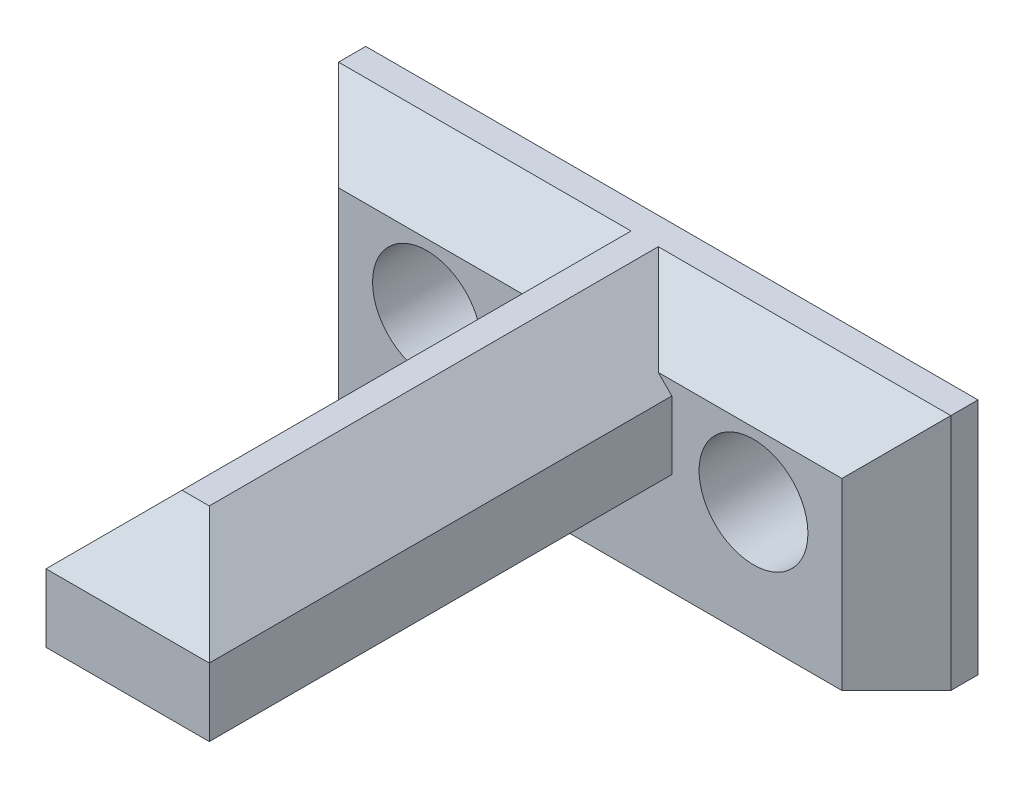
from build123d import *

# Parameters (mm, degrees)
SKETCH1_W           = 22.5
SKETCH1_H           = 8.75
SKETCH1_R           = 2
BOSS_EXTRUDE1_DEPTH = 3
SKETCH2_W           = 3
SKETCH2_H           = 17
BOSS_EXTRUDE2_DEPTH = 5
CHAMFER1_SIZE       = 2
CHAMFER2_SIZE       = 2.5


with BuildPart() as part:
    # Sketch1 → Boss-Extrude1 (new body)
    with BuildSketch(Plane.XY):
        Rectangle(SKETCH1_W, SKETCH1_H)
        with Locations((6, 0)):
            Circle(SKETCH1_R, mode=Mode.SUBTRACT)
        with Locations(Location((-6, 0, 0), (0, 0, 180))):
            Circle(SKETCH1_R, mode=Mode.SUBTRACT)
    extrude(amount=BOSS_EXTRUDE1_DEPTH)

    # Sketch2 → Boss-Extrude2 (add)
    with BuildSketch(Plane(origin=(0, 4.375, 0), x_dir=(1, 0, 0), z_dir=(0, 1, 0))):
        with Locations((-1.5, -11.5)):
            Rectangle(SKETCH2_W, SKETCH2_H)
        with Locations((1.5, -11.5)):
            Rectangle(SKETCH2_W, SKETCH2_H)
    extrude(amount=-BOSS_EXTRUDE2_DEPTH)

    # Chamfer1
    chamfer1_edges = [part.edges().sort_by_distance(p)[0] for p in [
        (-11.25, 0, 3),
        (-7.125, 4.375, 3),
        (11.25, 0, 3),
        (7.125, 4.375, 3),
    ]]
    chamfer(chamfer1_edges, length=CHAMFER1_SIZE)

    # Chamfer2
    # the kernel refuses this chamfer: 2.5 mm, written as the material it takes off along each edge
    with BuildSketch(Plane(origin=(3, 4.375, 26.42920747), x_dir=(0.027495876610586317, -0.9996219169112968, 0), z_dir=(0, 0, -1))) as chamfer2_piece_1_section:
        Polygon((CHAMFER2_SIZE * 0.999621916911, CHAMFER2_SIZE * 0.0274958766106), (-CHAMFER2_SIZE * 0.0274958766106, CHAMFER2_SIZE * 0.999621916911), (0, 0), align=None)
    chamfer2_piece_1 = extrude(amount=31.85841494, mode=Mode.PRIVATE)
    chamfer2_piece_1 = split(chamfer2_piece_1, bisect_by=Plane(origin=(2.16638878, 3.54222244, 3), z_dir=(0, 0, 1)), keep=Keep.TOP, mode=Mode.PRIVATE)
    add(chamfer2_piece_1, mode=Mode.SUBTRACT)
    with BuildSketch(Plane(origin=(3, 4.375, 26.42920747), x_dir=(0.027495876610586317, -0.9996219169112968, 0), z_dir=(0, 0, -1))) as chamfer2_piece_2_section:
        Polygon((CHAMFER2_SIZE * 0.999621916911, CHAMFER2_SIZE * 0.0274958766106), (-CHAMFER2_SIZE * 0.0274958766106, CHAMFER2_SIZE * 0.999621916911), (0, 0), align=None)
    chamfer2_piece_2 = extrude(amount=31.85841494, mode=Mode.PRIVATE)
    chamfer2_piece_2 = split(chamfer2_piece_2, bisect_by=Plane(origin=(2.022727273, 3.465909091, 1.909090909), z_dir=(0, 0.7071067811865476, 0.7071067811865476)), keep=Keep.TOP, mode=Mode.PRIVATE)
    add(chamfer2_piece_2, mode=Mode.SUBTRACT)
    with BuildSketch(Plane(origin=(9.42920747, 4.375, 20), x_dir=(0, -0.9996219169112968, 0.027495876610586317), z_dir=(-1, 0, 0))) as chamfer2_piece_3:
        Polygon((CHAMFER2_SIZE * 0.999621916911, -CHAMFER2_SIZE * 0.0274958766106), (-CHAMFER2_SIZE * 0.0274958766106, -CHAMFER2_SIZE * 0.999621916911), (0, 0), align=None)
    extrude(amount=18.85841494, mode=Mode.SUBTRACT)
    with BuildSketch(Plane(origin=(-3, 4.375, -5.42920747), x_dir=(-0.027495876610586147, -0.9996219169112968, 0), z_dir=(0, 0, 1))) as chamfer2_piece_4_section:
        Polygon((CHAMFER2_SIZE * 0.999621916911, CHAMFER2_SIZE * 0.0274958766106), (-CHAMFER2_SIZE * 0.0274958766106, CHAMFER2_SIZE * 0.999621916911), (0, 0), align=None)
    chamfer2_piece_4 = extrude(amount=31.85841494, mode=Mode.PRIVATE)
    chamfer2_piece_4 = split(chamfer2_piece_4, bisect_by=Plane(origin=(-2.022727273, 3.465909091, 1.909090909), z_dir=(0, 0.7071067811865476, 0.7071067811865476)), keep=Keep.TOP, mode=Mode.PRIVATE)
    add(chamfer2_piece_4, mode=Mode.SUBTRACT)
    with BuildSketch(Plane(origin=(-3, 4.375, -5.42920747), x_dir=(-0.027495876610586147, -0.9996219169112968, 0), z_dir=(0, 0, 1))) as chamfer2_piece_5_section:
        Polygon((CHAMFER2_SIZE * 0.999621916911, CHAMFER2_SIZE * 0.0274958766106), (-CHAMFER2_SIZE * 0.0274958766106, CHAMFER2_SIZE * 0.999621916911), (0, 0), align=None)
    chamfer2_piece_5 = extrude(amount=31.85841494, mode=Mode.PRIVATE)
    chamfer2_piece_5 = split(chamfer2_piece_5, bisect_by=Plane(origin=(-2.875, 2.125, 3), z_dir=(0, 0, 1)), keep=Keep.TOP, mode=Mode.PRIVATE)
    add(chamfer2_piece_5, mode=Mode.SUBTRACT)


solid = part.part
